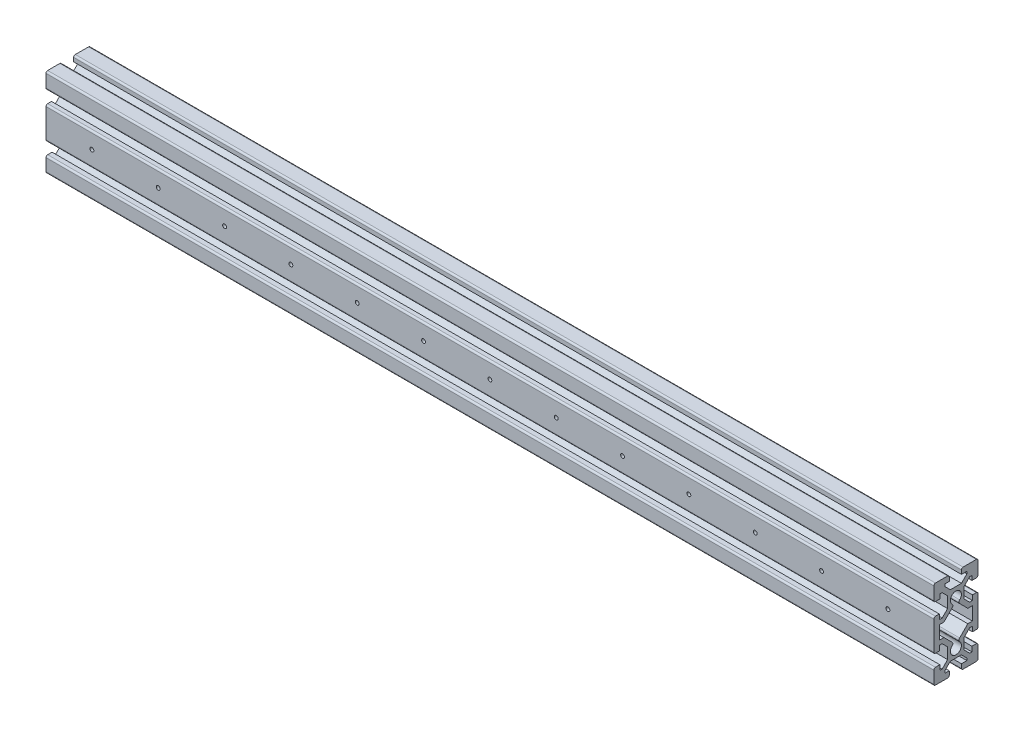
from build123d import *

# Parameters (mm, degrees)
ESTRUSIONE_ESTRUSIONE1_DEPTH = 803
SCHIZZO2_R                   = 1.75
TAGLIO_ESTRUSIONE1_DEPTH     = 10


with BuildPart() as part:
    # Schizzo1 → Estrusione-Estrusione1 (new body)
    with BuildSketch(Plane(origin=(0, 0, 0), x_dir=(0, 0, -1), z_dir=(1, 0, 0))):
        with BuildLine():
            Line((6.5, -39.5), (18.5, -39.5))
            ThreePointArc((18.5, -39.5), (19.560660172, -39.060660172), (20, -38))
            Line((20, -38), (20, -27))
            ThreePointArc((20, -27), (19.560660172, -25.939339828), (18.5, -25.5))
            Line((18.5, -25.5), (14.5, -25.5))
            Line((14.5, -25.5), (14.5, -29.949747468))
            Line((14.5, -29.949747468), (12.449747468, -29.949747468))
            Line((12.449747468, -29.949747468), (7.5, -25))
            Line((7.5, -25), (7.5, -15))
            Line((7.5, -15), (12.449747468, -10.050252532))
            Line((12.449747468, -10.050252532), (15, -10.050252532))
            Line((15, -10.050252532), (15, -14.5))
            Line((15, -14.5), (18.5, -14.5))
            ThreePointArc((18.5, -14.5), (19.560660172, -14.060660172), (20, -13))
            Line((20, -13), (20, 13))
            ThreePointArc((20, 13), (19.560660172, 14.060660172), (18.5, 14.5))
            Line((18.5, 14.5), (15, 14.5))
            Line((15, 14.5), (15, 10.050252532))
            Line((15, 10.050252532), (12.449747468, 10.050252532))
            Line((12.449747468, 10.050252532), (7.5, 15))
            Line((7.5, 15), (7.5, 25))
            Line((7.5, 25), (12.449747468, 29.949747468))
            Line((12.449747468, 29.949747468), (14.5, 29.949747468))
            Line((14.5, 29.949747468), (14.5, 26))
            Line((14.5, 26), (18.5, 26))
            ThreePointArc((18.5, 26), (19.560660172, 26.439339828), (20, 27.5))
            Line((20, 27.5), (20, 39))
            ThreePointArc((20, 39), (19.560660172, 40.060660172), (18.5, 40.5))
            Line((18.5, 40.5), (6.5, 40.5))
            ThreePointArc((6.5, 40.5), (5.439339828, 40.060660172), (5, 39))
            Line((5, 39), (5, 35.5))
            Line((5, 35.5), (9.949747468, 35.5))
            Line((9.949747468, 35.5), (9.949747468, 33.449747468))
            Line((9.949747468, 33.449747468), (5, 28.5))
            Line((5, 28.5), (-5, 28.5))
            Line((-5, 28.5), (-9.949747468, 33.449747468))
            Line((-9.949747468, 33.449747468), (-9.949747468, 35.5))
            Line((-9.949747468, 35.5), (-6, 35.5))
            Line((-6, 35.5), (-6, 39))
            ThreePointArc((-6, 39), (-6.439339828, 40.060660172), (-7.5, 40.5))
            Line((-7.5, 40.5), (-18.5, 40.5))
            ThreePointArc((-18.5, 40.5), (-19.560660172, 40.060660172), (-20, 39))
            Line((-20, 39), (-20, 27.5))
            ThreePointArc((-20, 27.5), (-19.560660172, 26.439339828), (-18.5, 26))
            Line((-18.5, 26), (-14.5, 26))
            Line((-14.5, 26), (-14.5, 29.949747468))
            Line((-14.5, 29.949747468), (-12.449747468, 29.949747468))
            Line((-12.449747468, 29.949747468), (-7.5, 25))
            Line((-7.5, 25), (-7.5, 15))
            Line((-7.5, 15), (-12.449747468, 10.050252532))
            Line((-12.449747468, 10.050252532), (-15, 10.050252532))
            Line((-15, 10.050252532), (-15, 14.5))
            Line((-15, 14.5), (-18.5, 14.5))
            ThreePointArc((-18.5, 14.5), (-19.560660172, 14.060660172), (-20, 13))
            Line((-20, 13), (-20, -13))
            ThreePointArc((-20, -13), (-19.560660172, -14.060660172), (-18.5, -14.5))
            Line((-18.5, -14.5), (-15, -14.5))
            Line((-15, -14.5), (-15, -10.050252532))
            Line((-15, -10.050252532), (-12.449747468, -10.050252532))
            Line((-12.449747468, -10.050252532), (-7.5, -15))
            Line((-7.5, -15), (-7.5, -25))
            Line((-7.5, -25), (-12.449747468, -29.949747468))
            Line((-12.449747468, -29.949747468), (-14.5, -29.949747468))
            Line((-14.5, -29.949747468), (-14.5, -25.5))
            Line((-14.5, -25.5), (-18.5, -25.5))
            ThreePointArc((-18.5, -25.5), (-19.560660172, -25.939339828), (-20, -27))
            Line((-20, -27), (-20, -38))
            ThreePointArc((-20, -38), (-19.560660172, -39.060660172), (-18.5, -39.5))
            Line((-18.5, -39.5), (-7.5, -39.5))
            ThreePointArc((-7.5, -39.5), (-6.439339828, -39.060660172), (-6, -38))
            Line((-6, -38), (-6, -34.5))
            Line((-6, -34.5), (-9.949747468, -34.5))
            Line((-9.949747468, -34.5), (-9.949747468, -32.449747468))
            Line((-9.949747468, -32.449747468), (-5, -27.5))
            Line((-5, -27.5), (5, -27.5))
            Line((5, -27.5), (9.949747468, -32.449747468))
            Line((9.949747468, -32.449747468), (9.949747468, -34.5))
            Line((9.949747468, -34.5), (5, -34.5))
            Line((5, -34.5), (5, -38))
            ThreePointArc((5, -38), (5.439339828, -39.060660172), (6.5, -39.5))
        make_face()
        with BuildLine():
            Line((-15, -6.050252532), (-15, 6.050252532))
            Line((-15, 6.050252532), (-10.792893219, 6.050252532))
            Line((-10.792893219, 6.050252532), (-3.368595607, 13.474550144))
            ThreePointArc((-3.368595607, 13.474550144), (-2.783084428, 14.921944422), (-3.416292264, 16.349116933))
            ThreePointArc((-3.416292264, 16.349116933), (0, 25), (3.416292264, 16.349116933))
            ThreePointArc((3.416292264, 16.349116933), (2.783084428, 14.921944422), (3.368595607, 13.474550144))
            Line((3.368595607, 13.474550144), (10.792893219, 6.050252532))
            Line((10.792893219, 6.050252532), (15, 6.050252532))
            Line((15, 6.050252532), (15, -6.050252532))
            Line((15, -6.050252532), (10.792893219, -6.050252532))
            Line((10.792893219, -6.050252532), (3.368595607, -13.474550144))
            ThreePointArc((3.368595607, -13.474550144), (2.783084428, -14.921944422), (3.416292264, -16.349116933))
            ThreePointArc((3.416292264, -16.349116933), (0, -25), (-3.416292264, -16.349116933))
            ThreePointArc((-3.416292264, -16.349116933), (-2.783084428, -14.921944422), (-3.368595607, -13.474550144))
            Line((-3.368595607, -13.474550144), (-10.792893219, -6.050252532))
            Line((-10.792893219, -6.050252532), (-15, -6.050252532))
        make_face(mode=Mode.SUBTRACT)
    extrude(amount=ESTRUSIONE_ESTRUSIONE1_DEPTH)

    # Schizzo2 → Taglio-Estrusione1 (cut)
    with BuildSketch(Plane.XY.offset(20)):
        with Locations((401.5, 0)):
            Circle(SCHIZZO2_R)
        with Locations((461.5, 0)):
            Circle(SCHIZZO2_R)
        with Locations((521.5, 0)):
            Circle(SCHIZZO2_R)
        with Locations((581.5, 0)):
            Circle(SCHIZZO2_R)
        with Locations((641.5, 0)):
            Circle(SCHIZZO2_R)
        with Locations((701.5, 0)):
            Circle(SCHIZZO2_R)
        with Locations((761.5, 0)):
            Circle(SCHIZZO2_R)
        with Locations((41.5, 0)):
            Circle(SCHIZZO2_R)
        with Locations((101.5, 0)):
            Circle(SCHIZZO2_R)
        with Locations((161.5, 0)):
            Circle(SCHIZZO2_R)
        with Locations((221.5, 0)):
            Circle(SCHIZZO2_R)
        with Locations((281.5, 0)):
            Circle(SCHIZZO2_R)
        with Locations((341.5, 0)):
            Circle(SCHIZZO2_R)
    extrude(amount=-TAGLIO_ESTRUSIONE1_DEPTH, mode=Mode.SUBTRACT)


solid = part.part
